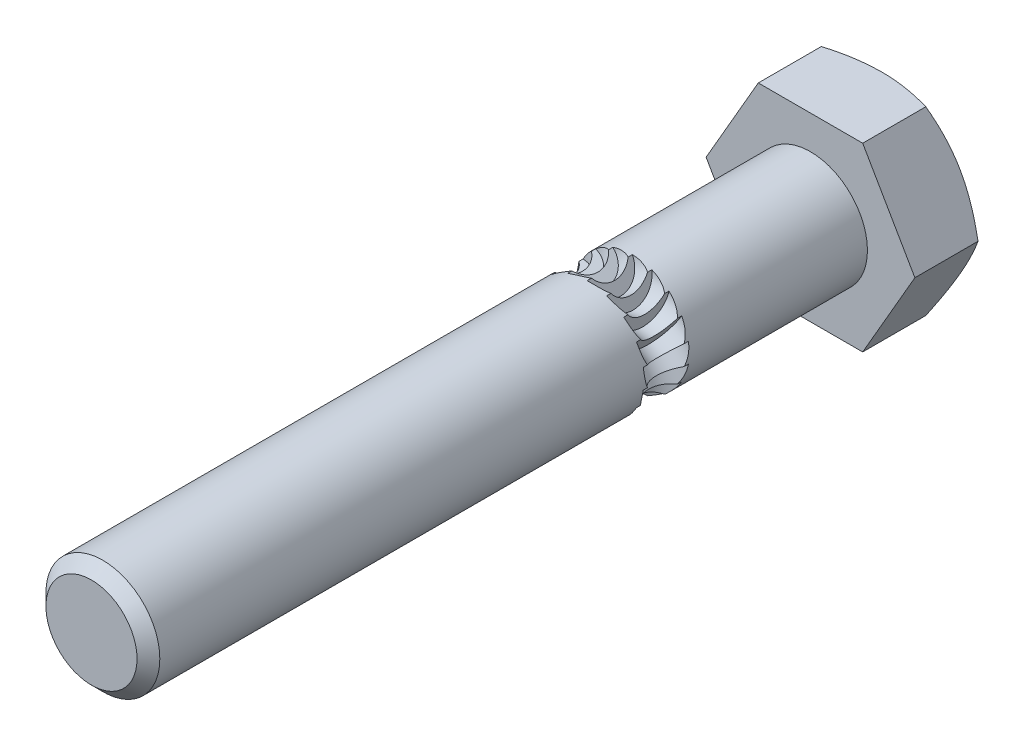
from build123d import *

# Parameters (mm, degrees)
SKETCH1_R          = 4
BOLT_BODY_DEPTH    = 50.5
BOLT_HEAD_DEPTH    = 5
CUT_EXTRUDE2_START = 2
SKETCH5_R          = 1.5875
CUT_EXTRUDE2_DEPTH = 50.423106026
CIRPATTERN1_COUNT  = 18
CHAMFER1_SIZE      = 0.8
SKETCH6_OUTSIDE_W  = 63.064
SKETCH6_OUTSIDE_H  = 61.1
SKETCH6_OUTSIDE_R  = 6.35
CUT_EXTRUDE3_DEPTH = 10
CUT_EXTRUDE3_DRAFT = -60


with BuildPart() as part:
    # Sketch1 → Bolt Body (new body)
    with BuildSketch(Plane.XY):
        Circle(SKETCH1_R)
    extrude(amount=BOLT_BODY_DEPTH)

    # Sketch3 → Bolt Head (add)
    with BuildSketch(Plane.XY):
        Polygon((7.332348419, 0), (3.666174209, 6.35), (-3.666174209, 6.35), (-7.332348419, 0), (-3.666174209, -6.35), (3.666174209, -6.35), align=None)
    extrude(amount=-BOLT_HEAD_DEPTH)

    # Sketch5 → Cut-Extrude2 (cut, through all)
    with BuildSketch(Plane(origin=(0, 0, 0), x_dir=(1, 0, 0), z_dir=(0, 1, 0)).offset(CUT_EXTRUDE2_START)):
        with Locations((-3.5, -14.1)):
            Circle(SKETCH5_R)
    cut_extrude2 = extrude(amount=CUT_EXTRUDE2_DEPTH, mode=Mode.SUBTRACT)

    # CirPattern1: Cut-Extrude2 ×18 about axis
    cirpattern1_axis = Axis((0, 0, -10.381222937), (0, 0, 1))
    for i in range(1, CIRPATTERN1_COUNT):
        add(cut_extrude2.rotate(cirpattern1_axis, i * 360 / CIRPATTERN1_COUNT), mode=Mode.SUBTRACT)

    # Chamfer1
    chamfer1_edges = [part.edges().sort_by_distance(p)[0] for p in [
        (-4, 0, 50.5),
    ]]
    chamfer(chamfer1_edges, length=CHAMFER1_SIZE)


with BuildPart() as cut_extrude3_tool:
    # Sketch6 outside → Cut-Extrude3 (with draft: the straight prism first)
    with BuildSketch(Plane(origin=(0, 0, -5), x_dir=(-1, 0, 0), z_dir=(0, 0, -1))):
        Rectangle(SKETCH6_OUTSIDE_W, SKETCH6_OUTSIDE_H)
        Circle(SKETCH6_OUTSIDE_R, mode=Mode.SUBTRACT)
    extrude(amount=-CUT_EXTRUDE3_DEPTH)
    # Cut-Extrude3: the draft: its side faces are tilted about the plane it starts from
    cut_extrude3_sides = [cut_extrude3_tool.faces().sort_by_distance(p)[0] for p in [
        (0, -30.55, 0),
        (-31.532, 0, 0),
        (0, 30.55, 0),
        (31.532, 0, 0),
        (6.35, 0, 0),
    ]]
    draft(cut_extrude3_sides, Plane(origin=(0, 0, -5), x_dir=(-1, 0, 0), z_dir=(0, 0, -1)), CUT_EXTRUDE3_DRAFT)


with BuildPart() as part_1:
    add(part.part)

    # Cut-Extrude3: cut by cut_extrude3_tool
    add(cut_extrude3_tool.part, mode=Mode.SUBTRACT)


solid = part_1.part
